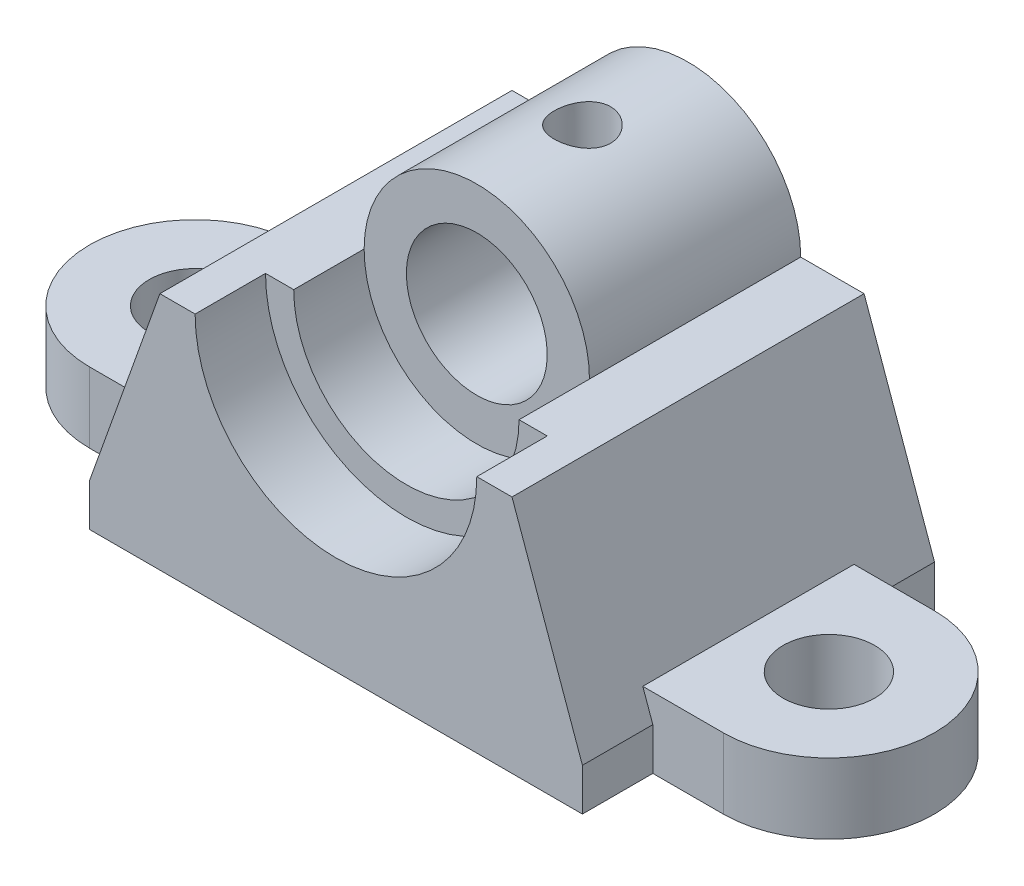
from build123d import *

# Parameters (mm, degrees)
EXTRUDE_1_DEPTH     = 50
SKETCH_3_R          = 20
SKETCH_3_R_2        = 16
CUT_EXTRUDE_1_DEPTH = 10
CUT_EXTRUDE_2_DEPTH = 70.864153899
EXTRUDE_START       = -30
SKETCH_4_R          = 16
SKETCH_4_R_2        = 10
EXTRUDE_2_DEPTH     = 30
CUT_EXTRUDE_START   = 43.165151137
CUT_EXTRUDE_3_DEPTH = 6.834848863
SKETCH_6_R          = 6.5
EXTRUDE_3_DEPTH     = 10


# Read off the part's stored shape, not the designer's step: 切除-拉伸3
with BuildPart() as part:
    # 草图1 → 凸台-拉伸1 (new body)
    with BuildSketch(Plane.XY):
        Polygon((-35, 6), (-25, 34), (25, 34), (35, 6), (35, 0), (-35, 0), align=None)
    extrude(amount=-EXTRUDE_1_DEPTH)

    # 草图3 → 切除-拉伸1 (cut)
    with BuildSketch(Plane.XY):
        with Locations((0, 34)):
            Circle(SKETCH_3_R)
        with Locations((0, 34)):
            Circle(SKETCH_3_R_2, mode=Mode.SUBTRACT)
    extrude(amount=-CUT_EXTRUDE_1_DEPTH, mode=Mode.SUBTRACT)

    # 草图3<2> → 切除-拉伸2 (cut, through all)
    with BuildSketch(Plane.XY):
        with BuildLine():
            Line((-16, 34), (16, 34))
            ThreePointArc((16, 34), (0, 50), (-16, 34))
        make_face()
        with BuildLine():
            ThreePointArc((-16, 34), (0, 18), (16, 34))
            Line((16, 34), (-16, 34))
        make_face()
    extrude(amount=-CUT_EXTRUDE_2_DEPTH, mode=Mode.SUBTRACT)

    # 草图4 → 凸台-拉伸2 (add)
    with BuildSketch(Plane(origin=(0, 0, -50), x_dir=(-1, 0, 0), z_dir=(0, 0, -1)).offset(EXTRUDE_START)):
        with Locations((0, 34)):
            Circle(SKETCH_4_R)
        with Locations((0, 34)):
            Circle(SKETCH_4_R_2, mode=Mode.SUBTRACT)
    extrude(amount=EXTRUDE_2_DEPTH)

    # 切除-拉伸3 outline → 切除-拉伸3 (cut)
    with BuildSketch(Plane(origin=(0, 0, 0), x_dir=(1, 0, 0), z_dir=(0, 1, 0)).offset(CUT_EXTRUDE_START)):
        with BuildLine():
            add(Edge.make_bspline(
                [(3.99999996, 35), (3.999967414, 36.053927104), (3.563514164, 37.092301246), (2.830425635, 37.826427201), (2.096738851, 38.561151707), (1.06888327, 39), (-1.068884266, 39), (-2.100127628, 38.557285469), (-2.829510993, 37.827342841), (-3.558894179, 37.09740029), (-3.998804852, 36.060507963), (-4.001190045, 33.948526829), (-3.561222969, 32.904953883), (-2.829556469, 32.172702671), (-2.097890055, 31.440451664), (-1.056916053, 31.001093572), (1.048622532, 30.998910725), (2.090006878, 31.433217451), (2.82830312, 32.171448876), (3.566599135, 32.909680204), (3.999318272, 33.942605173), (3.999999722, 34.998278644), (3.999999987, 34.999139327), (3.99999996, 35)],
                knots=[0.750101996, 0.750101996, 0.750101996, 0.750101996, 0.875, 0.875, 0.875000116, 1, 1, 1.124999999, 1.124999999, 1.125000021, 1.249999998, 1.249999998, 1.374999984, 1.374999984, 1.375000009, 1.499999969, 1.499999969, 1.624999954, 1.624999954, 1.624999981, 1.749999938, 1.749999938, 1.750101934, 1.750101934, 1.750101934, 1.750101934], degree=3))
        make_face()
    extrude(amount=CUT_EXTRUDE_3_DEPTH, mode=Mode.SUBTRACT)

    # 草图6 → 凸台-拉伸3 (add)
    # profile 1 of 2: a face of its own
    with BuildSketch(Plane(origin=(0, 0, 0), x_dir=(1, 0, 0), z_dir=(0, 1, 0))):
        with BuildLine():
            Line((-35, 40), (-45, 40))
            ThreePointArc((-45, 40), (-60, 25), (-45, 10))
            Line((-45, 10), (-35, 10))
            Line((-35, 10), (35, 10))
            Line((35, 10), (35, 40))
            Line((35, 40), (-35, 40))
        make_face()
        with Locations(Location((-45, 25, 0), (0, 0, 270))):
            Circle(SKETCH_6_R, mode=Mode.SUBTRACT)
    # profile 2 of 2: a face of its own
    with BuildSketch(Plane(origin=(0, 0, 0), x_dir=(1, 0, 0), z_dir=(0, 1, 0))):
        with BuildLine():
            ThreePointArc((45, 40), (60, 25), (45, 10))
            Line((45, 10), (35, 10))
            Line((35, 10), (35, 40))
            Line((35, 40), (45, 40))
        make_face()
        with Locations(Location((45, 25, 0), (0, 0, 270))):
            Circle(SKETCH_6_R, mode=Mode.SUBTRACT)
    extrude(amount=EXTRUDE_3_DEPTH)


solid = part.part
